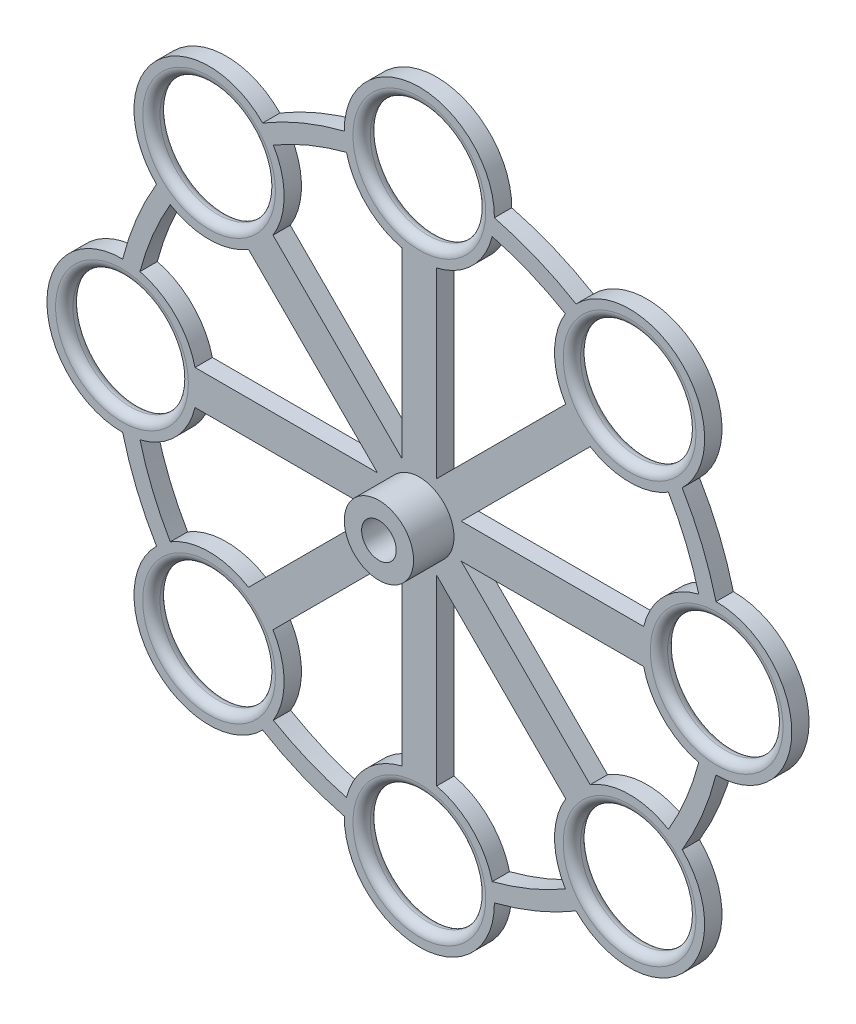
from build123d import *

# Parameters (mm, degrees)
CROQUIS1_R              = 3
CROQUIS1_R_2            = 10
SALIENTE_EXTRUIR2_DEPTH = 3
REDONDEO1_R             = 1.5
REDONDEO2_R             = 1.5
REDONDEO3_R             = 1.5
REDONDEO4_R             = 1.5
REDONDEO5_R             = 1.5
REDONDEO6_R             = 1.5
REDONDEO7_R             = 1.5
REDONDEO8_R             = 1.5
REDONDEO9_R             = 1.5
REDONDEO10_R            = 1.5
REDONDEO11_R            = 1.5
REDONDEO12_R            = 1.5
REDONDEO13_R            = 1.5
REDONDEO14_R            = 1.5
REDONDEO15_R            = 1.5
REDONDEO16_R            = 1.5
CROQUIS18_R             = 6
CROQUIS18_R_2           = 3
SALIENTE_EXTRUIR5_DEPTH = 7


with BuildPart() as part:
    # Croquis1 → Saliente-Extruir2 (new body)
    with BuildSketch(Plane.XY):
        with BuildLine():
            ThreePointArc((-45.523905039, 27.139898121), (-48.965615223, 20.282221915), (-51.381067961, 12.999455957))
            ThreePointArc((-51.381067961, 12.999455957), (-64.5, 0), (-51.381067961, -12.999455957))
            ThreePointArc((-51.381067961, -12.999455957), (-48.965615223, -20.282221915), (-45.523905039, -27.139898121))
            ThreePointArc((-45.523905039, -27.139898121), (-45.608387387, -45.608387387), (-27.139898121, -45.523905039))
            ThreePointArc((-27.139898121, -45.523905039), (-20.282221915, -48.965615223), (-12.999455957, -51.381067961))
            ThreePointArc((-12.999455957, -51.381067961), (0, -64.5), (12.999455957, -51.381067961))
            ThreePointArc((12.999455957, -51.381067961), (20.282221915, -48.965615223), (27.139898121, -45.523905039))
            ThreePointArc((27.139898121, -45.523905039), (45.608387387, -45.608387387), (45.523905039, -27.139898121))
            ThreePointArc((45.523905039, -27.139898121), (48.965615223, -20.282221915), (51.381067961, -12.999455957))
            ThreePointArc((51.381067961, -12.999455957), (64.5, 0), (51.381067961, 12.999455957))
            ThreePointArc((51.381067961, 12.999455957), (48.965615223, 20.282221915), (45.523905039, 27.139898121))
            ThreePointArc((45.523905039, 27.139898121), (45.608387387, 45.608387387), (27.139898121, 45.523905039))
            ThreePointArc((27.139898121, 45.523905039), (20.282221915, 48.965615223), (12.999455957, 51.381067961))
            ThreePointArc((12.999455957, 51.381067961), (0, 64.5), (-12.999455957, 51.381067961))
            ThreePointArc((-12.999455957, 51.381067961), (-20.282221915, 48.965615223), (-27.139898121, 45.523905039))
            ThreePointArc((-27.139898121, 45.523905039), (-45.608387387, 45.608387387), (-45.523905039, 27.139898121))
        make_face()
        Circle(CROQUIS1_R, mode=Mode.SUBTRACT)
        with Locations((0, 51.5)):
            Circle(CROQUIS1_R_2, mode=Mode.SUBTRACT)
        with Locations((-36.415999231, 36.415999231)):
            Circle(CROQUIS1_R_2, mode=Mode.SUBTRACT)
        with Locations((-51.5, 0)):
            Circle(CROQUIS1_R_2, mode=Mode.SUBTRACT)
        with Locations((-36.415999231, -36.415999231)):
            Circle(CROQUIS1_R_2, mode=Mode.SUBTRACT)
        with Locations((0, -51.5)):
            Circle(CROQUIS1_R_2, mode=Mode.SUBTRACT)
        with Locations((36.415999231, -36.415999231)):
            Circle(CROQUIS1_R_2, mode=Mode.SUBTRACT)
        with Locations((51.5, 0)):
            Circle(CROQUIS1_R_2, mode=Mode.SUBTRACT)
        with Locations((36.415999231, 36.415999231)):
            Circle(CROQUIS1_R_2, mode=Mode.SUBTRACT)
        with BuildLine():
            Line((-7.242640687, 3), (-38.850889359, 3))
            ThreePointArc((-38.850889359, 3), (-42.264449614, 9.149022301), (-48.381067961, 12.620311523))
            ThreePointArc((-48.381067961, 12.620311523), (-46.193976626, 19.134171618), (-43.134489095, 25.286673378))
            ThreePointArc((-43.134489095, 25.286673378), (-36.354814635, 23.416143215), (-29.593047665, 25.350406978))
            Line((-29.593047665, 25.350406978), (-7.242640687, 3))
        make_face(mode=Mode.SUBTRACT)
        with BuildLine():
            Line((-7.242894262, -3), (-29.593889088, -25.349888207))
            ThreePointArc((-29.593889088, -25.349888207), (-36.355308876, -23.416140898), (-43.134489095, -25.286673378))
            ThreePointArc((-43.134489095, -25.286673378), (-46.193976626, -19.134171618), (-48.381067961, -12.620311523))
            ThreePointArc((-48.381067961, -12.620311523), (-42.264449614, -9.149022301), (-38.850889359, -3))
            Line((-38.850889359, -3), (-7.242894262, -3))
        make_face(mode=Mode.SUBTRACT)
        with BuildLine():
            Line((-3, -7.242387126), (-3, -38.850889359))
            ThreePointArc((-3, -38.850889359), (-9.149022301, -42.264449614), (-12.620311523, -48.381067961))
            ThreePointArc((-12.620311523, -48.381067961), (-19.134171618, -46.193976626), (-25.286673378, -43.134489095))
            ThreePointArc((-25.286673378, -43.134489095), (-23.41614555, -36.35432041), (-25.350925796, -29.592206306))
            Line((-25.350925796, -29.592206306), (-3, -7.242387126))
        make_face(mode=Mode.SUBTRACT)
        with BuildLine():
            Line((3, -7.242640687), (25.350406978, -29.593047665))
            ThreePointArc((25.350406978, -29.593047665), (23.416143215, -36.354814635), (25.286673378, -43.134489095))
            ThreePointArc((25.286673378, -43.134489095), (19.134171618, -46.193976626), (12.620311523, -48.381067961))
            ThreePointArc((12.620311523, -48.381067961), (9.149022301, -42.264449614), (3, -38.850889359))
            Line((3, -38.850889359), (3, -7.242640687))
        make_face(mode=Mode.SUBTRACT)
        with BuildLine():
            Line((7.242387126, -3), (38.850889359, -3))
            ThreePointArc((38.850889359, -3), (42.264449614, -9.149022301), (48.381067961, -12.620311523))
            ThreePointArc((48.381067961, -12.620311523), (46.193976626, -19.134171618), (43.134489095, -25.286673378))
            ThreePointArc((43.134489095, -25.286673378), (36.35432041, -23.41614555), (29.592206307, -25.350925796))
            Line((29.592206307, -25.350925796), (7.242387126, -3))
        make_face(mode=Mode.SUBTRACT)
        with BuildLine():
            Line((7.242387126, 3), (29.592206307, 25.350925796))
            ThreePointArc((29.592206307, 25.350925796), (36.35432041, 23.41614555), (43.134489095, 25.286673378))
            ThreePointArc((43.134489095, 25.286673378), (46.193976626, 19.134171618), (48.381067961, 12.620311523))
            ThreePointArc((48.381067961, 12.620311523), (42.264449614, 9.149022301), (38.850889359, 3))
            Line((38.850889359, 3), (7.242387126, 3))
        make_face(mode=Mode.SUBTRACT)
        with BuildLine():
            Line((3, 7.242387127), (3, 38.850889359))
            ThreePointArc((3, 38.850889359), (9.149022301, 42.264449614), (12.620311523, 48.381067961))
            ThreePointArc((12.620311523, 48.381067961), (19.134171618, 46.193976626), (25.286673378, 43.134489095))
            ThreePointArc((25.286673378, 43.134489095), (23.41614555, 36.35432041), (25.350925796, 29.592206307))
            Line((25.350925796, 29.592206307), (3, 7.242387127))
        make_face(mode=Mode.SUBTRACT)
        with BuildLine():
            Line((-3, 7.242640687), (-25.350406978, 29.593047665))
            ThreePointArc((-25.350406978, 29.593047665), (-23.416143215, 36.354814635), (-25.286673378, 43.134489095))
            ThreePointArc((-25.286673378, 43.134489095), (-19.134171618, 46.193976626), (-12.620311523, 48.381067961))
            ThreePointArc((-12.620311523, 48.381067961), (-9.149022301, 42.264449614), (-3, 38.850889359))
            Line((-3, 38.850889359), (-3, 7.242640687))
        make_face(mode=Mode.SUBTRACT)
    extrude(amount=SALIENTE_EXTRUIR2_DEPTH)

    # Redondeo1
    redondeo1_edges = [part.edges().sort_by_distance(p)[0] for p in [
        (41.5, 0, 3),
    ]]
    fillet(redondeo1_edges, radius=REDONDEO1_R)

    # Redondeo2
    redondeo2_edges = [part.edges().sort_by_distance(p)[0] for p in [
        (41.5, 0, 0),
    ]]
    fillet(redondeo2_edges, radius=REDONDEO2_R - 0.0001)  # a hair under: the kernel refuses the full size

    # Redondeo3
    redondeo3_edges = [part.edges().sort_by_distance(p)[0] for p in [
        (26.415999231, -36.415999231, 0),
    ]]
    fillet(redondeo3_edges, radius=REDONDEO3_R)

    # Redondeo4
    redondeo4_edges = [part.edges().sort_by_distance(p)[0] for p in [
        (26.415999231, -36.415999231, 3),
    ]]
    fillet(redondeo4_edges, radius=REDONDEO4_R - 0.0001)  # a hair under: the kernel refuses the full size

    # Redondeo5
    redondeo5_edges = [part.edges().sort_by_distance(p)[0] for p in [
        (-10, -51.5, 0),
    ]]
    fillet(redondeo5_edges, radius=REDONDEO5_R)

    # Redondeo6
    redondeo6_edges = [part.edges().sort_by_distance(p)[0] for p in [
        (-10, -51.5, 3),
    ]]
    fillet(redondeo6_edges, radius=REDONDEO6_R - 0.0001)  # a hair under: the kernel refuses the full size

    # Redondeo7
    redondeo7_edges = [part.edges().sort_by_distance(p)[0] for p in [
        (-46.415999231, -36.415999231, 0),
    ]]
    fillet(redondeo7_edges, radius=REDONDEO7_R)

    # Redondeo8
    redondeo8_edges = [part.edges().sort_by_distance(p)[0] for p in [
        (-46.415999231, -36.415999231, 3),
    ]]
    fillet(redondeo8_edges, radius=REDONDEO8_R - 0.0001)  # a hair under: the kernel refuses the full size

    # Redondeo9
    redondeo9_edges = [part.edges().sort_by_distance(p)[0] for p in [
        (-61.5, 0, 0),
    ]]
    fillet(redondeo9_edges, radius=REDONDEO9_R)

    # Redondeo10
    redondeo10_edges = [part.edges().sort_by_distance(p)[0] for p in [
        (-61.5, 0, 3),
    ]]
    fillet(redondeo10_edges, radius=REDONDEO10_R - 0.0001)  # a hair under: the kernel refuses the full size

    # Redondeo11
    redondeo11_edges = [part.edges().sort_by_distance(p)[0] for p in [
        (-46.415999231, 36.415999231, 0),
    ]]
    fillet(redondeo11_edges, radius=REDONDEO11_R)

    # Redondeo12
    redondeo12_edges = [part.edges().sort_by_distance(p)[0] for p in [
        (-46.415999231, 36.415999231, 3),
    ]]
    fillet(redondeo12_edges, radius=REDONDEO12_R - 0.0001)  # a hair under: the kernel refuses the full size

    # Redondeo13
    redondeo13_edges = [part.edges().sort_by_distance(p)[0] for p in [
        (-10, 51.5, 0),
    ]]
    fillet(redondeo13_edges, radius=REDONDEO13_R)

    # Redondeo14
    redondeo14_edges = [part.edges().sort_by_distance(p)[0] for p in [
        (-10, 51.5, 3),
    ]]
    fillet(redondeo14_edges, radius=REDONDEO14_R - 0.0001)  # a hair under: the kernel refuses the full size

    # Redondeo15
    redondeo15_edges = [part.edges().sort_by_distance(p)[0] for p in [
        (26.415999231, 36.415999231, 0),
    ]]
    fillet(redondeo15_edges, radius=REDONDEO15_R)

    # Redondeo16
    redondeo16_edges = [part.edges().sort_by_distance(p)[0] for p in [
        (26.415999231, 36.415999231, 3),
    ]]
    fillet(redondeo16_edges, radius=REDONDEO16_R - 0.0001)  # a hair under: the kernel refuses the full size

    # Croquis18 → Saliente-Extruir5 (add)
    with BuildSketch(Plane.XY.offset(3)):
        Circle(CROQUIS18_R)
        Circle(CROQUIS18_R_2, mode=Mode.SUBTRACT)
    extrude(amount=SALIENTE_EXTRUIR5_DEPTH)


solid = part.part
